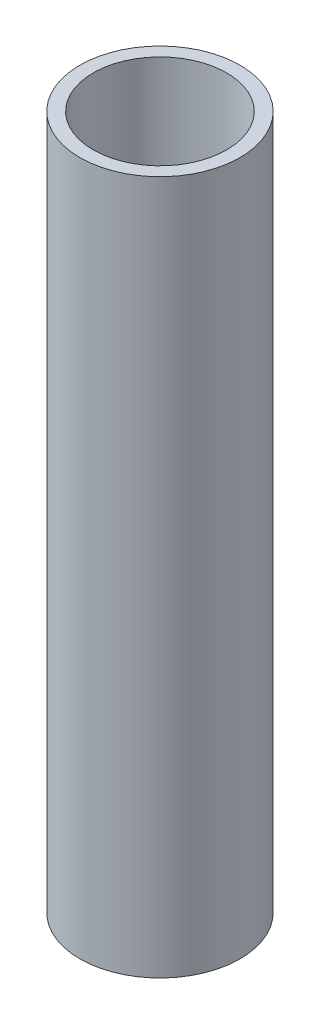
from build123d import *

# Parameters (mm, degrees)
SKETCH1_R           = 4.7625
SKETCH1_R_2         = 3.96875
BOSS_EXTRUDE1_DEPTH = 41.275


with BuildPart() as part:
    # Sketch1 → Boss-Extrude1 (new body)
    with BuildSketch(Plane(origin=(0, 0, 0), x_dir=(1, 0, 0), z_dir=(0, 1, 0))):
        Circle(SKETCH1_R)
        Circle(SKETCH1_R_2, mode=Mode.SUBTRACT)
    extrude(amount=BOSS_EXTRUDE1_DEPTH)


solid = part.part
